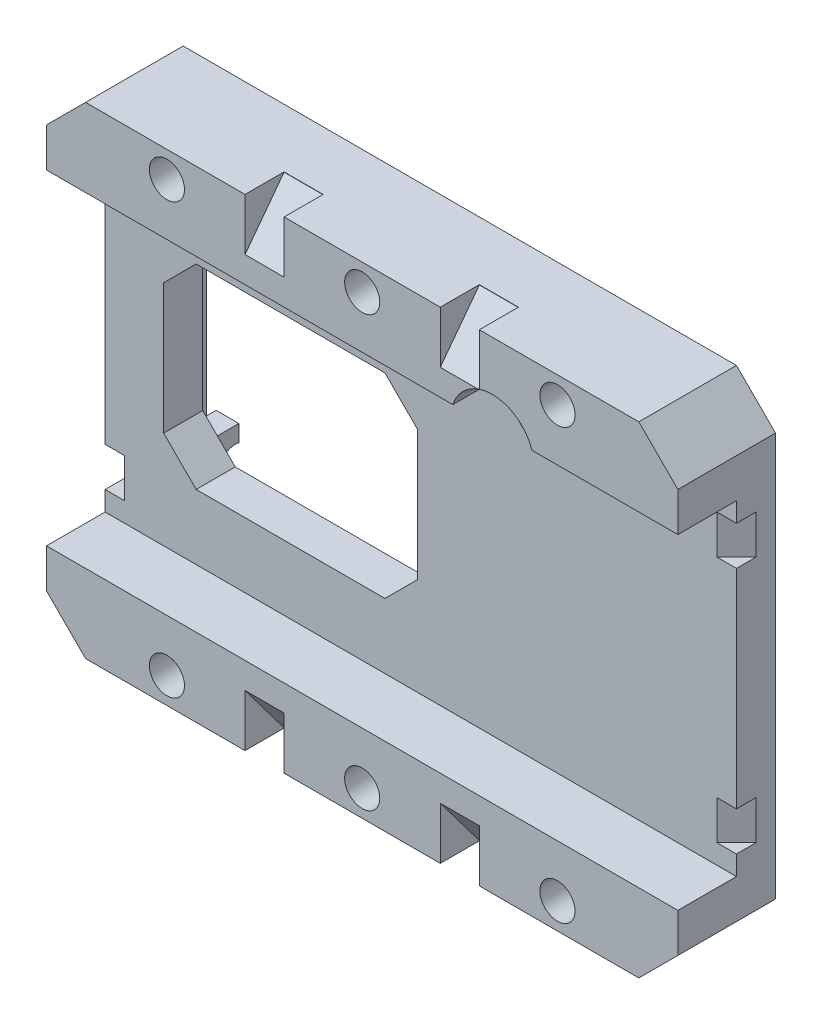
from build123d import *
from OCP.BRepFilletAPI import BRepFilletAPI_MakeChamfer

# Parameters (mm, degrees)
SKETCH_1_W                  = 48.5
SKETCH_1_H                  = 37
EXTRUDE_1_DEPTH             = 7.5
SKETCH_2_W                  = 4.5
SKETCH_2_H                  = 25
CUT_EXTRUDE_1_DEPTH         = 54.398977368
SKETCH_3_W                  = 41
SKETCH_3_H                  = 27.5
EXTRUDE_2_DEPTH             = 3.028
SKETCH_4_W                  = 38.25
SKETCH_4_H                  = 25
CUT_EXTRUDE_2_DEPTH         = 3.028
CUT_EXTRUDE_3_DEPTH         = 49.015109955
CUT_EXTRUDE_4_DEPTH         = 52.139033859
CUT_EXTRUDE_5_DEPTH         = 32.090983966
HOLE_WIZARD_2_5_2_5_1_D     = 2.5
HOLE_WIZARD_2_5_2_5_1_DEPTH = 1.75
HOLE_WIZARD_2_5_2_5_2_D     = 2.5
HOLE_WIZARD_2_5_2_5_2_DEPTH = 6
HOLE_WIZARD_2_5_2_5_3_D     = 2.5
HOLE_WIZARD_2_5_2_5_3_DEPTH = 4.25
HOLE_WIZARD_2_7_2_7_1_D     = 2.7
CHAMFER_1_SIZE              = 3
SKETCH_17_W                 = 3
SKETCH_17_H                 = 4
CUT_EXTRUDE_8_DEPTH         = 3
CHAMFER_2_SIZE              = 3
CHAMFER_2_SIZE_2            = 3.981134465
SKETCH_19_W                 = 2
SKETCH_19_H                 = 3
CUT_EXTRUDE_9_DEPTH         = 1.5
CHAMFER_3_SIZE              = 2
CHAMFER_4_SIZE              = 1
SKETCH_20_R                 = 3.2
CUT_EXTRUDE_10_DEPTH        = 21.5
SKETCH_21_W                 = 19.5
SKETCH_21_H                 = 15
CUT_EXTRUDE_11_DEPTH        = 21.5
CHAMFER_5_SIZE              = 2.5
SKETCH_22_W                 = 9
SKETCH_22_H                 = 15
CUT_EXTRUDE_12_DEPTH        = 51.5


# Some blends are built 0.0001 mm under size
with BuildPart() as part:
    # 草图1 → 凸台-拉伸1 (new body)
    with BuildSketch(Plane(origin=(0, 0, 5.028), x_dir=(-1, 0, 0), z_dir=(0, 0, -1))):
        Rectangle(SKETCH_1_W, SKETCH_1_H)
    extrude(amount=-EXTRUDE_1_DEPTH)

    # 草图2 → 切除-拉伸1 (cut, through all)
    with BuildSketch(Plane(origin=(24.25, 0, 0), x_dir=(0, 0, -1), z_dir=(1, 0, 0))):
        with Locations((-10.278, 0)):
            Rectangle(SKETCH_2_W, SKETCH_2_H)
    extrude(amount=-CUT_EXTRUDE_1_DEPTH, mode=Mode.SUBTRACT)

    # 草图3 → 凸台-拉伸2 (add)
    with BuildSketch(Plane(origin=(0, 0, 5.028), x_dir=(-1, 0, 0), z_dir=(0, 0, -1))):
        with Locations((1.25, 0)):
            Rectangle(SKETCH_3_W, SKETCH_3_H)
    extrude(amount=EXTRUDE_2_DEPTH)

    # 草图4 → 切除-拉伸2 (cut)
    with BuildSketch(Plane(origin=(0, 0, 2), x_dir=(-1, 0, 0), z_dir=(0, 0, -1))):
        with Locations((0.875, 0)):
            Rectangle(SKETCH_4_W, SKETCH_4_H)
    extrude(amount=-CUT_EXTRUDE_2_DEPTH, mode=Mode.SUBTRACT)

    # 草图5 → 切除-拉伸3 (cut, through all)
    with BuildSketch(Plane.ZY.offset(-18.25)):
        with BuildLine():
            Line((2, 7.034395212), (2, -7.034395212))
            ThreePointArc((2, -7.034395212), (4.278, 0), (2, 7.034395212))
        make_face()
    extrude(amount=-CUT_EXTRUDE_3_DEPTH, mode=Mode.SUBTRACT)

    # 草图6 → 切除-拉伸4 (cut, through all)
    with BuildSketch(Plane.ZY.offset(21.75)):
        with BuildLine():
            Line((2, 7.034395212), (2, -7.034395212))
            ThreePointArc((2, -7.034395212), (4.278, 0), (2, 7.034395212))
        make_face()
    extrude(amount=-CUT_EXTRUDE_4_DEPTH, mode=Mode.SUBTRACT)

    # 草图7 → 切除-拉伸5 (cut, through all)
    with BuildSketch(Plane.XY.offset(8.028)):
        with BuildLine():
            Line((-7.978419869, 7.029222073), (-13.021580131, 7.029222073))
            ThreePointArc((-13.021580131, 7.029222073), (-17.801221513, 4.934335949), (-19.5, 0))
            ThreePointArc((-19.5, 0), (-17.801221513, -4.934335949), (-13.021580131, -7.029222073))
            Line((-13.021580131, -7.029222073), (-7.978419869, -7.029222073))
            ThreePointArc((-7.978419869, -7.029222073), (-3.198778487, -4.934335949), (-1.5, 0))
            ThreePointArc((-1.5, 0), (-3.198778487, 4.934335949), (-7.978419869, 7.029222073))
        make_face()
    extrude(amount=-CUT_EXTRUDE_5_DEPTH, mode=Mode.SUBTRACT)

    # Ø2.5 (2.5) 直径孔1
    with Locations(Plane.ZY.offset(21.75)):
        with Locations((2.278, 10)):
            Hole(HOLE_WIZARD_2_5_2_5_1_D / 2, depth=HOLE_WIZARD_2_5_2_5_1_DEPTH)

    # Ø2.5 (2.5) 直径孔2
    with Locations(Plane.ZY.offset(-18.25)):
        with Locations((2.278, -10), (2.278, 10)):
            Hole(HOLE_WIZARD_2_5_2_5_2_D / 2, depth=HOLE_WIZARD_2_5_2_5_2_DEPTH)

    # Ø2.5 (2.5) 直径孔3
    with Locations(Plane(origin=(-20, 0, 0), x_dir=(0, 0, -1), z_dir=(1, 0, 0))):
        with Locations((-2.278, -10)):
            Hole(HOLE_WIZARD_2_5_2_5_3_D / 2, depth=HOLE_WIZARD_2_5_2_5_3_DEPTH)

    # Ø2.7 (2.7) 直径孔1 (through all)
    with Locations(Plane.XY.offset(12.528)):
        with Locations((0, -16.5), (-15, -16.5), (15, -16.5), (0, 16.5), (-15, 16.5), (15, 16.5)):
            Hole(HOLE_WIZARD_2_7_2_7_1_D / 2)

    # 倒角1
    chamfer_1_edges = [part.edges().sort_by_distance(p)[0] for p in [
        (-24.25, 18.5, 8.778),
        (-24.25, -18.5, 8.778),
        (24.25, -18.5, 8.778),
        (24.25, 18.5, 8.778),
    ]]
    chamfer(chamfer_1_edges, length=CHAMFER_1_SIZE)

    # 草图17 → 切除-拉伸8 (cut)
    with BuildSketch(Plane.XY.offset(12.528)):
        with Locations((-7.5, -16.5)):
            Rectangle(SKETCH_17_W, SKETCH_17_H)
        with Locations((7.5, -16.5)):
            Rectangle(SKETCH_17_W, SKETCH_17_H)
        with Locations((7.5, 16.5)):
            Rectangle(SKETCH_17_W, SKETCH_17_H)
        with Locations((-7.5, 16.5)):
            Rectangle(SKETCH_17_W, SKETCH_17_H)
    extrude(amount=-CUT_EXTRUDE_8_DEPTH, mode=Mode.SUBTRACT)

    # 倒角2
    chamfer_2_edges_1 = [part.edges().sort_by_distance(p)[0] for p in [
        (7.5, -14.5, 9.528),
    ]]
    chamfer_2_side_1 = [part.faces().sort_by_distance(p)[0] for p in [
        (7.5, -14.5, 9.588),
    ]]
    chamfer_2_edges_2 = [part.edges().sort_by_distance(p)[0] for p in [
        (-7.5, -14.5, 9.528),
    ]]
    chamfer_2_side_2 = [part.faces().sort_by_distance(p)[0] for p in [
        (-7.5, -14.5, 9.588),
    ]]
    chamfer_2_edges_3 = [part.edges().sort_by_distance(p)[0] for p in [
        (-7.5, 14.5, 9.528),
    ]]
    chamfer_2_side_3 = [part.faces().sort_by_distance(p)[0] for p in [
        (-7.5, 14.5, 9.588),
    ]]
    chamfer_2_edges_4 = [part.edges().sort_by_distance(p)[0] for p in [
        (7.5, 14.5, 9.528),
    ]]
    chamfer_2_side_4 = [part.faces().sort_by_distance(p)[0] for p in [
        (7.5, 14.5, 9.588),
    ]]
    chamfer_2 = BRepFilletAPI_MakeChamfer(part.part.solid().wrapped)
    for e in chamfer_2_edges_1:
        chamfer_2.Add(CHAMFER_2_SIZE - 0.0001, CHAMFER_2_SIZE_2 - 0.0001, e.wrapped, chamfer_2_side_1[0].wrapped)
    for e in chamfer_2_edges_2:
        chamfer_2.Add(CHAMFER_2_SIZE - 0.0001, CHAMFER_2_SIZE_2 - 0.0001, e.wrapped, chamfer_2_side_2[0].wrapped)
    for e in chamfer_2_edges_3:
        chamfer_2.Add(CHAMFER_2_SIZE - 0.0001, CHAMFER_2_SIZE_2 - 0.0001, e.wrapped, chamfer_2_side_3[0].wrapped)
    for e in chamfer_2_edges_4:
        chamfer_2.Add(CHAMFER_2_SIZE - 0.0001, CHAMFER_2_SIZE_2 - 0.0001, e.wrapped, chamfer_2_side_4[0].wrapped)
    add(Compound.cast(chamfer_2.Shape()), mode=Mode.REPLACE)  # a hair under: the kernel refuses the full size

    # 草图19 → 切除-拉伸9 (cut)
    with BuildSketch(Plane.XY.offset(8.028)):
        with Locations((-23.25, -9.5)):
            Rectangle(SKETCH_19_W, SKETCH_19_H)
        with Locations((-23.25, 9.5)):
            Rectangle(SKETCH_19_W, SKETCH_19_H)
        with Locations((23.25, 9.5)):
            Rectangle(SKETCH_19_W, SKETCH_19_H)
        with Locations((23.25, -9.5)):
            Rectangle(SKETCH_19_W, SKETCH_19_H)
    extrude(amount=-CUT_EXTRUDE_9_DEPTH, mode=Mode.SUBTRACT)

    # 倒角3
    # the kernel refuses this chamfer: 2 mm, written as the material it adds along each edge
    with BuildSketch(Plane(origin=(22.25, 11, 6.528), x_dir=(0.9996219169112968, 0, -0.02749587661058651), z_dir=(0, -1, 0))) as chamfer_3_piece_1_section:
        Polygon((CHAMFER_3_SIZE * 0.999621916911, CHAMFER_3_SIZE * 0.0274958766106), (-CHAMFER_3_SIZE * 0.0274958766106, CHAMFER_3_SIZE * 0.999621916911), (0, 0), align=None)
    chamfer_3_piece_1 = extrude(amount=8.143365976, mode=Mode.PRIVATE)
    chamfer_3_piece_1 = split(chamfer_3_piece_1, bisect_by=Plane(origin=(22.95, 9.5, 8.028), z_dir=(0, 0, -1)), keep=Keep.TOP, mode=Mode.PRIVATE)
    add(chamfer_3_piece_1)
    with BuildSketch(Plane(origin=(22.25, -11, 6.528), x_dir=(0.9996219169112968, 0, -0.02749587661058651), z_dir=(0, 1, 0))) as chamfer_3_piece_2_section:
        Polygon((CHAMFER_3_SIZE * 0.999621916911, -CHAMFER_3_SIZE * 0.0274958766106), (-CHAMFER_3_SIZE * 0.0274958766106, -CHAMFER_3_SIZE * 0.999621916911), (0, 0), align=None)
    chamfer_3_piece_2 = extrude(amount=8.143365976, mode=Mode.PRIVATE)
    chamfer_3_piece_2 = split(chamfer_3_piece_2, bisect_by=Plane(origin=(22.95, -9.5, 8.028), z_dir=(0, 0, -1)), keep=Keep.TOP, mode=Mode.PRIVATE)
    add(chamfer_3_piece_2)
    with BuildSketch(Plane(origin=(-22.25, 11, 6.528), x_dir=(-0.9996219169112968, 0, -0.02749587661058651), z_dir=(0, -1, 0))) as chamfer_3_piece_3_section:
        Polygon((CHAMFER_3_SIZE * 0.999621916911, -CHAMFER_3_SIZE * 0.0274958766106), (-CHAMFER_3_SIZE * 0.0274958766106, -CHAMFER_3_SIZE * 0.999621916911), (0, 0), align=None)
    chamfer_3_piece_3 = extrude(amount=8.143365976, mode=Mode.PRIVATE)
    chamfer_3_piece_3 = split(chamfer_3_piece_3, bisect_by=Plane(origin=(-22.95, 9.5, 8.028), z_dir=(0, 0, -1)), keep=Keep.TOP, mode=Mode.PRIVATE)
    add(chamfer_3_piece_3)
    with BuildSketch(Plane(origin=(-22.25, -16.143365976, 6.528), x_dir=(-0.9996219169112968, 0, -0.02749587661058651), z_dir=(0, 1, 0))) as chamfer_3_piece_4_section:
        Polygon((CHAMFER_3_SIZE * 0.999621916911, CHAMFER_3_SIZE * 0.0274958766106), (-CHAMFER_3_SIZE * 0.0274958766106, CHAMFER_3_SIZE * 0.999621916911), (0, 0), align=None)
    chamfer_3_piece_4 = extrude(amount=13.286731952, mode=Mode.PRIVATE)
    chamfer_3_piece_4 = split(chamfer_3_piece_4, bisect_by=Plane(origin=(-22.95, -9.5, 8.028), z_dir=(0, 0, -1)), keep=Keep.TOP, mode=Mode.PRIVATE)
    chamfer_3_piece_4 = split(chamfer_3_piece_4, bisect_by=Plane(origin=(-26.6, -13.15, 7.128), z_dir=(0.7071067811865476, 0.7071067811865476, 0)), keep=Keep.TOP, mode=Mode.PRIVATE)
    add(chamfer_3_piece_4)

    # 倒角4
    chamfer_4_edges = [part.edges().sort_by_distance(p)[0] for p in [
        (-21.75, 13.75, 3.514),
        (19.25, 13.75, 3.514),
        (19.25, -13.75, 3.514),
        (-21.75, -13.75, 3.514),
    ]]
    chamfer(chamfer_4_edges, length=CHAMFER_4_SIZE)

    # 草图20 → 切除-拉伸10 (cut)
    with BuildSketch(Plane(origin=(0, 0, 2), x_dir=(-1, 0, 0), z_dir=(0, 0, -1))):
        with Locations(Location((-10, 11.5, 0), (0, 0, 18.209956864))):
            Circle(SKETCH_20_R)
    extrude(amount=-CUT_EXTRUDE_10_DEPTH, mode=Mode.SUBTRACT)

    # 草图21 → 切除-拉伸11 (cut)
    with BuildSketch(Plane.XY.offset(8.028)):
        with Locations((-10, 0)):
            Rectangle(SKETCH_21_W, SKETCH_21_H)
    extrude(amount=-CUT_EXTRUDE_11_DEPTH, mode=Mode.SUBTRACT)

    # 倒角5
    chamfer_5_edges = [part.edges().sort_by_distance(p)[0] for p in [
        (-0.25, 7.5, 6.528),
        (-0.25, -7.5, 6.528),
        (-19.75, -7.5, 6.528),
        (-19.75, 7.5, 6.528),
    ]]
    chamfer(chamfer_5_edges, length=CHAMFER_5_SIZE)

    # 草图22 → 切除-拉伸12 (cut)
    with BuildSketch(Plane(origin=(19.25, 0, 0), x_dir=(0, 0, -1), z_dir=(1, 0, 0))):
        Rectangle(SKETCH_22_W, SKETCH_22_H)
    extrude(amount=-CUT_EXTRUDE_12_DEPTH, mode=Mode.SUBTRACT)


solid = part.part
